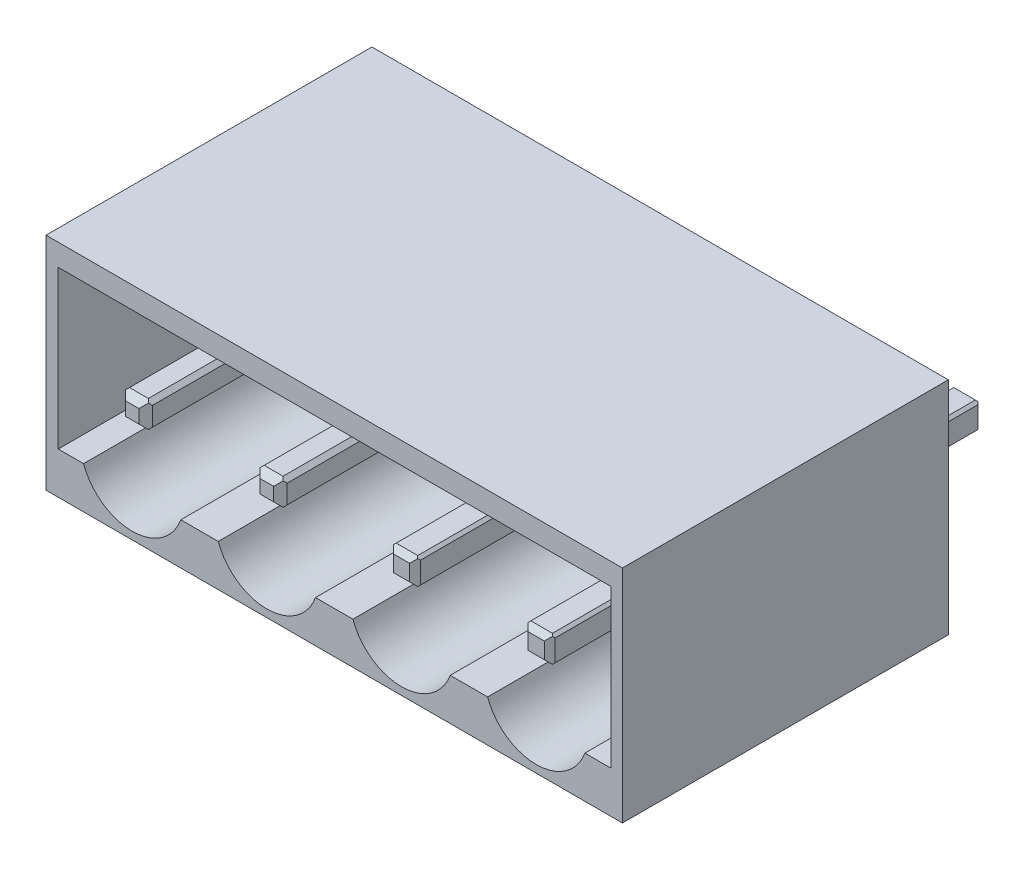
from build123d import *

# Parameters (mm, degrees)
SKETCH_1_W          = 21.4
SKETCH_1_H          = 8.2
EXTRUDE_1_DEPTH     = 12.1
SKETCH_4_R          = 1.25
CUT_EXTRUDE_3_DEPTH = 8
CUT_EXTRUDE_4_DEPTH = 7.8
SKETCH_7_W          = 1
SKETCH_7_H          = 1
EXTRUDE_2_DEPTH     = 8
CHAMFER_1_SIZE      = 0.15
CHAMFER_2_SIZE      = 0.25
SKETCH_8_W          = 1
SKETCH_8_H          = 1
EXTRUDE_3_DEPTH     = 4
CHAMFER_6_SIZE      = 0.1
CHAMFER_7_SIZE      = 0.2
CHAMFER_10_SIZE     = 0.1
CHAMFER_11_SIZE     = 0.2
CHAMFER_12_SIZE     = 0.1
CHAMFER_13_SIZE     = 0.2
CHAMFER_14_SIZE     = 0.1
CHAMFER_15_SIZE     = 0.2


with BuildPart() as part:
    # Эскиз1 → Бобышка-Вытянуть1 (new body)
    with BuildSketch(Plane.XY):
        Rectangle(SKETCH_1_W, SKETCH_1_H)
    extrude(amount=EXTRUDE_1_DEPTH)

    # Эскиз4 → Вырез-Вытянуть3 (cut)
    with BuildSketch(Plane.XY.offset(12.1)):
        with Locations((-7.5, 0)):
            Circle(SKETCH_4_R)
        with Locations((-2.5, 0)):
            Circle(SKETCH_4_R)
        with Locations((2.5, 0)):
            Circle(SKETCH_4_R)
        with Locations((7.5, 0)):
            Circle(SKETCH_4_R)
    extrude(amount=-CUT_EXTRUDE_3_DEPTH, mode=Mode.SUBTRACT)

    # Эскиз5 → Вырез-Вытянуть4 (cut)
    with BuildSketch(Plane.XY.offset(12.1)):
        with BuildLine():
            Line((-10.245621634, 0), (-10.245621634, 3.292901982))
            Line((-10.245621634, 3.292901982), (0.278509544, 3.292901982))
            Line((0.278509544, 3.292901982), (5.278509544, 3.292901982))
            Line((5.278509544, 3.292901982), (10.278509544, 3.292901982))
            Line((10.278509544, 3.292901982), (10.278509544, -2.548957219))
            Line((10.278509544, -2.548957219), (9.30582632, -2.548957219))
            ThreePointArc((9.30582632, -2.548957219), (7.5, -3.818893996), (5.69417368, -2.548957219))
            Line((5.69417368, -2.548957219), (4.30582632, -2.548957219))
            ThreePointArc((4.30582632, -2.548957219), (2.5, -3.818893996), (0.69417368, -2.548957219))
            Line((0.69417368, -2.548957219), (-0.69417368, -2.548957219))
            ThreePointArc((-0.69417368, -2.548957219), (-2.5, -3.818893996), (-4.30582632, -2.548957219))
            Line((-4.30582632, -2.548957219), (-5.69417368, -2.548957219))
            ThreePointArc((-5.69417368, -2.548957219), (-7.5, -3.818893996), (-9.30582632, -2.548957219))
            Line((-9.30582632, -2.548957219), (-10.245621634, -2.548957219))
            Line((-10.245621634, -2.548957219), (-10.245621634, 0))
        make_face()
    extrude(amount=-CUT_EXTRUDE_4_DEPTH, mode=Mode.SUBTRACT)

    # Эскиз7 → Бобышка-Вытянуть2 (add)
    with BuildSketch(Plane.XY.offset(4.1)):
        with Locations((-2.5, 0)):
            Rectangle(SKETCH_7_W, SKETCH_7_H)
        with Locations((-7.5, 0)):
            Rectangle(SKETCH_7_W, SKETCH_7_H)
        with Locations((2.5, 0)):
            Rectangle(SKETCH_7_W, SKETCH_7_H)
        with Locations((7.5, 0)):
            Rectangle(SKETCH_7_W, SKETCH_7_H)
    extrude(amount=EXTRUDE_2_DEPTH)

    # Фаска1
    chamfer_1_edges = [part.edges().sort_by_distance(p)[0] for p in [
        (-7, -0.5, 8.1),
        (-7, 0.5, 8.1),
        (-8, 0.5, 8.1),
        (-8, -0.5, 8.1),
        (-2, -0.5, 8.1),
        (-2, 0.5, 8.1),
        (-3, 0.5, 8.1),
        (-3, -0.5, 8.1),
    ]]
    chamfer(chamfer_1_edges, length=CHAMFER_1_SIZE)

    # Фаска2
    # the kernel refuses this chamfer: 0.25 mm, written as the material it takes off along each edge
    with BuildSketch(Plane(origin=(-3, -0.992920747, 12.1), x_dir=(-0.02749587661058555, 0, -0.9996219169112968), z_dir=(0, 1, 0)), Plane(origin=(-3.492920747, 0.5, 12.1), x_dir=(0, 0.027495876610586414, -0.9996219169112968), z_dir=(1, 0, 0)), Plane(origin=(-2, 0.992920747, 12.1), x_dir=(0.027495876610586414, 0, -0.9996219169112968), z_dir=(0, -1, 0)), Plane(origin=(-1.507079253, -0.5, 12.1), x_dir=(0, -0.027495876610586414, -0.9996219169112968), z_dir=(-1, 0, 0)), Plane(origin=(-7, 0.992920747, 12.1), x_dir=(0.02749587661058555, 0, -0.9996219169112968), z_dir=(0, -1, 0)), Plane(origin=(-6.507079253, -0.5, 12.1), x_dir=(0, -0.027495876610586414, -0.9996219169112968), z_dir=(-1, 0, 0)), Plane(origin=(-8, -0.992920747, 12.1), x_dir=(-0.027495876610589005, 0, -0.9996219169112968), z_dir=(0, 1, 0)), Plane(origin=(-8.492920747, 0.5, 12.1), x_dir=(0, 0.027495876610586414, -0.9996219169112968), z_dir=(1, 0, 0))) as chamfer_2_piece_1:
        Polygon((CHAMFER_2_SIZE * 0.999621916911, -CHAMFER_2_SIZE * 0.0274958766106), (-CHAMFER_2_SIZE * 0.0274958766106, -CHAMFER_2_SIZE * 0.999621916911), (0, 0), align=None)
    extrude(amount=1.985841494, mode=Mode.SUBTRACT)

    # Эскиз8 → Бобышка-Вытянуть3 (add)
    with BuildSketch(Plane(origin=(0, -4.1, 0), x_dir=(-1, 0, 0), z_dir=(0, 0, 1))):
        with Locations((2.5, -3.75)):
            Rectangle(SKETCH_8_W, SKETCH_8_H)
        with Locations((7.5, -3.75)):
            Rectangle(SKETCH_8_W, SKETCH_8_H)
        with Locations((-2.5, -3.75)):
            Rectangle(SKETCH_8_W, SKETCH_8_H)
        with Locations((-7.5, -3.75)):
            Rectangle(SKETCH_8_W, SKETCH_8_H)
    extrude(amount=-EXTRUDE_3_DEPTH)

    # Фаска6
    chamfer_6_edges = [part.edges().sort_by_distance(p)[0] for p in [
        (3, -0.5, 8.1),
        (3, 0.5, 8.1),
        (2, 0.5, 8.1),
        (2, -0.5, 8.1),
    ]]
    chamfer(chamfer_6_edges, length=CHAMFER_6_SIZE)

    # Фаска7
    # the kernel refuses this chamfer: 0.2 mm, written as the material it takes off along each edge
    with BuildSketch(Plane(origin=(3, 0.914336598, 12.1), x_dir=(0.02749587661058742, 0, -0.9996219169112966), z_dir=(0, -1, 0)), Plane(origin=(3.414336598, -0.5, 12.1), x_dir=(0, -0.02749587661058634, -0.9996219169112966), z_dir=(-1, 0, 0)), Plane(origin=(2, -0.914336598, 12.1), x_dir=(-0.02749587661058634, 0, -0.9996219169112966), z_dir=(0, 1, 0)), Plane(origin=(1.585663402, 0.5, 12.1), x_dir=(0, 0.02749587661058634, -0.9996219169112966), z_dir=(1, 0, 0))) as chamfer_7_piece_1:
        Polygon((CHAMFER_7_SIZE * 0.999621916911, -CHAMFER_7_SIZE * 0.0274958766106), (-CHAMFER_7_SIZE * 0.0274958766106, -CHAMFER_7_SIZE * 0.999621916911), (0, 0), align=None)
    extrude(amount=1.828673195, mode=Mode.SUBTRACT)

    # Фаска10
    chamfer_10_edges = [part.edges().sort_by_distance(p)[0] for p in [
        (-7, 0.15, -2),
        (-7, -0.85, -2),
        (-8, -0.85, -2),
        (-8, 0.15, -2),
        (-2, 0.15, -2),
        (-2, -0.85, -2),
        (-3, -0.85, -2),
        (-3, 0.15, -2),
        (3, 0.15, -2),
        (3, -0.85, -2),
        (2, -0.85, -2),
        (2, 0.15, -2),
    ]]
    chamfer(chamfer_10_edges, length=CHAMFER_10_SIZE)

    # Фаска11
    # the kernel refuses this chamfer: 0.2 mm, written as the material it takes off along each edge
    with BuildSketch(Plane(origin=(-7, 0.564336598, -4), x_dir=(0.027495876610587302, 0, 0.9996219169112966), z_dir=(0, -1, 0)), Plane(origin=(-8.414336598, 0.15, -4), x_dir=(0, 0.027495876610586355, 0.9996219169112966), z_dir=(1, 0, 0)), Plane(origin=(-8, -1.264336598, -4), x_dir=(-0.027495876610587302, 0, 0.9996219169112966), z_dir=(0, 1, 0)), Plane(origin=(-6.585663402, -0.85, -4), x_dir=(0, -0.027495876610586223, 0.9996219169112966), z_dir=(-1, 0, 0)), Plane(origin=(-1.585663402, -0.85, -4), x_dir=(0, -0.027495876610586223, 0.9996219169112966), z_dir=(-1, 0, 0)), Plane(origin=(-3, -1.264336598, -4), x_dir=(-0.027495876610587302, 0, 0.9996219169112966), z_dir=(0, 1, 0)), Plane(origin=(-3.414336598, 0.15, -4), x_dir=(0, 0.027495876610586355, 0.9996219169112966), z_dir=(1, 0, 0)), Plane(origin=(-2, 0.564336598, -4), x_dir=(0.027495876610586223, 0, 0.9996219169112966), z_dir=(0, -1, 0)), Plane(origin=(2, -1.264336598, -4), x_dir=(-0.027495876610586223, 0, 0.9996219169112966), z_dir=(0, 1, 0)), Plane(origin=(1.585663402, 0.15, -4), x_dir=(0, 0.027495876610586355, 0.9996219169112966), z_dir=(1, 0, 0)), Plane(origin=(3, 0.564336598, -4), x_dir=(0.027495876610587302, 0, 0.9996219169112966), z_dir=(0, -1, 0)), Plane(origin=(3.414336598, -0.85, -4), x_dir=(0, -0.027495876610586223, 0.9996219169112966), z_dir=(-1, 0, 0))) as chamfer_11_piece_1:
        Polygon((CHAMFER_11_SIZE * 0.999621916911, CHAMFER_11_SIZE * 0.0274958766106), (-CHAMFER_11_SIZE * 0.0274958766106, CHAMFER_11_SIZE * 0.999621916911), (0, 0), align=None)
    extrude(amount=1.828673195, mode=Mode.SUBTRACT)

    # Фаска12
    chamfer_12_edges = [part.edges().sort_by_distance(p)[0] for p in [
        (8, 0.15, -2),
        (8, -0.85, -2),
        (7, -0.85, -2),
        (7, 0.15, -2),
    ]]
    chamfer(chamfer_12_edges, length=CHAMFER_12_SIZE)

    # Фаска13
    # the kernel refuses this chamfer: 0.2 mm, written as the material it takes off along each edge
    with BuildSketch(Plane(origin=(6.585663402, 0.15, -4), x_dir=(0, 0.027495876610586355, 0.9996219169112966), z_dir=(1, 0, 0)), Plane(origin=(8, 0.564336598, -4), x_dir=(0.027495876610587302, 0, 0.9996219169112966), z_dir=(0, -1, 0)), Plane(origin=(7, -1.264336598, -4), x_dir=(-0.027495876610587302, 0, 0.9996219169112966), z_dir=(0, 1, 0)), Plane(origin=(8.414336598, -0.85, -4), x_dir=(0, -0.027495876610586223, 0.9996219169112966), z_dir=(-1, 0, 0))) as chamfer_13_piece_1:
        Polygon((CHAMFER_13_SIZE * 0.999621916911, CHAMFER_13_SIZE * 0.0274958766106), (-CHAMFER_13_SIZE * 0.0274958766106, CHAMFER_13_SIZE * 0.999621916911), (0, 0), align=None)
    extrude(amount=1.828673195, mode=Mode.SUBTRACT)

    # Фаска14
    chamfer_14_edges = [part.edges().sort_by_distance(p)[0] for p in [
        (8, -0.5, 8.1),
        (8, 0.5, 8.1),
        (7, 0.5, 8.1),
        (7, -0.5, 8.1),
    ]]
    chamfer(chamfer_14_edges, length=CHAMFER_14_SIZE)

    # Фаска15
    # the kernel refuses this chamfer: 0.2 mm, written as the material it takes off along each edge
    with BuildSketch(Plane(origin=(7, -0.914336598, 12.1), x_dir=(-0.02749587661058742, 0, -0.9996219169112966), z_dir=(0, 1, 0)), Plane(origin=(8.414336598, -0.5, 12.1), x_dir=(0, -0.02749587661058634, -0.9996219169112966), z_dir=(-1, 0, 0)), Plane(origin=(8, 0.914336598, 12.1), x_dir=(0.02749587661058742, 0, -0.9996219169112966), z_dir=(0, -1, 0)), Plane(origin=(6.585663402, 0.5, 12.1), x_dir=(0, 0.02749587661058634, -0.9996219169112966), z_dir=(1, 0, 0))) as chamfer_15_piece_1:
        Polygon((CHAMFER_15_SIZE * 0.999621916911, -CHAMFER_15_SIZE * 0.0274958766106), (-CHAMFER_15_SIZE * 0.0274958766106, -CHAMFER_15_SIZE * 0.999621916911), (0, 0), align=None)
    extrude(amount=1.828673195, mode=Mode.SUBTRACT)


solid = part.part
